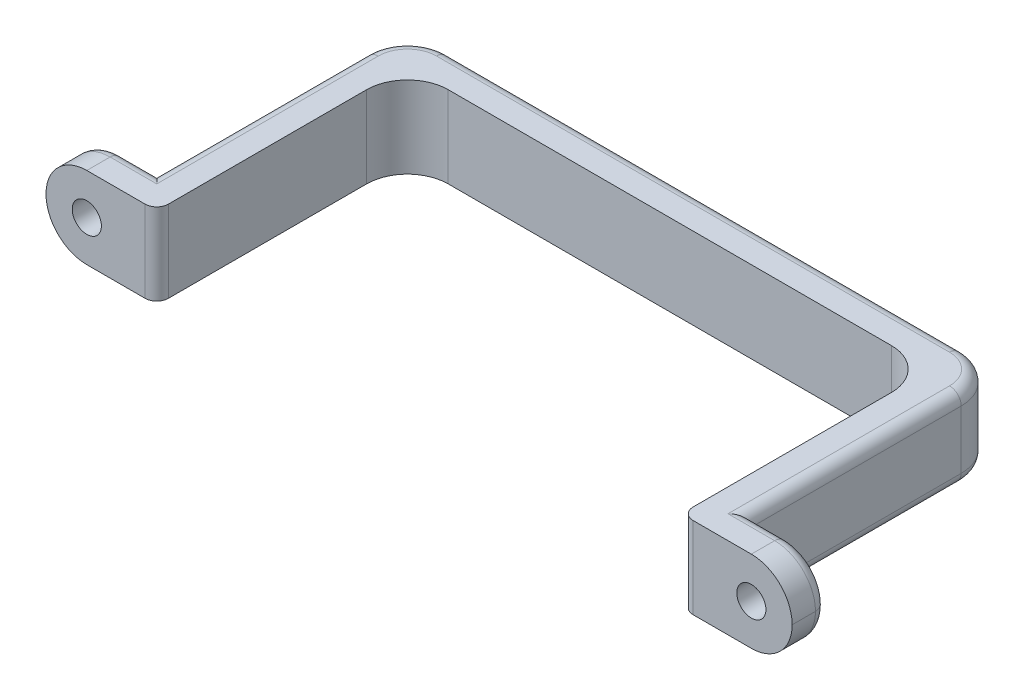
from build123d import *

# Parameters (mm, degrees)
SKETCH_1_W          = 6.5
SKETCH_1_H          = 3
SKETCH_1_W_2        = 22.5
EXTRUDE_1_DEPTH     = 7
FILLET_3_R          = 3.5
CUT_EXTRUDE_1_REACH = 70.886
SKETCH_2_R          = 1.25
FILLET_4_R          = 1
FILLET_5_R          = 1


with BuildPart() as part:
    # Эскиз1 → Бобышка-Вытянуть1 (new body)
    with BuildSketch(Plane(origin=(0, 0, 0), x_dir=(1, 0, 0), z_dir=(0, 1, 0))):
        with Locations((3.25, 1.5)):
            Rectangle(SKETCH_1_W, SKETCH_1_H)
        Polygon((9.5, 21.5), (9.5, 24.5), (6.5, 24.5), (6.5, 3), (6.5, 0), (9.5, 0), align=None)
        with Locations((20.75, 23)):
            Rectangle(SKETCH_1_W_2, SKETCH_1_H)
        with Locations((43.25, 23)):
            Rectangle(SKETCH_1_W_2, SKETCH_1_H)
        Polygon((57.5, 24.5), (54.5, 24.5), (54.5, 21.5), (54.5, 0), (57.5, 0), (57.5, 3), align=None)
        with Locations((60.75, 1.5)):
            Rectangle(SKETCH_1_W, SKETCH_1_H)
    extrude(amount=EXTRUDE_1_DEPTH)

    # Скругление3
    fillet_3_edges = [part.edges().sort_by_distance(p)[0] for p in [
        (64, 0, -1.5),
        (64, 7, -1.5),
        (0, 0, -1.5),
        (0, 7, -1.5),
        (57.5, 3.5, -24.5),
        (6.5, 3.5, -24.5),
        (54.5, 3.5, -21.5),
        (9.5, 3.5, -21.5),
    ]]
    fillet(fillet_3_edges, radius=FILLET_3_R - 0.0001)  # a hair under: the kernel refuses the full size

    # Эскиз2 → Вырез-Вытянуть1 (cut, up to next)
    with BuildSketch(Plane.XY, mode=Mode.PRIVATE) as cut_extrude_1_sk1:
        with Locations((3.5, 3.5)):
            Circle(SKETCH_2_R)
    cut_extrude_1_tool1 = extrude(cut_extrude_1_sk1.sketch, amount=-CUT_EXTRUDE_1_REACH, mode=Mode.PRIVATE) & part.part
    # Эскиз2 → Вырез-Вытянуть1 (cut, up to next)
    with BuildSketch(Plane.XY, mode=Mode.PRIVATE) as cut_extrude_1_sk2:
        with Locations((60.5, 3.5)):
            Circle(SKETCH_2_R)
    cut_extrude_1_tool2 = extrude(cut_extrude_1_sk2.sketch, amount=-CUT_EXTRUDE_1_REACH, mode=Mode.PRIVATE) & part.part
    add(cut_extrude_1_tool1.solids().sort_by_distance((3.5, 3.5, 0))[0], mode=Mode.SUBTRACT)
    add(cut_extrude_1_tool2.solids().sort_by_distance((60.5, 3.5, 0))[0], mode=Mode.SUBTRACT)

    # Скругление4
    fillet_4_edges = [part.edges().sort_by_distance(p)[0] for p in [
        (6.5, 0, -12.00005),
        (57.5, 0, -12.00005),
        (57.5, 7, -12.00005),
        (59.00005, 7, -3),
        (32, 7, -24.5),
        (4.99995, 7, -3),
        (7.525096977, 7, -23.474903023),
        (56.474903023, 7, -23.474903023),
        (59.00005, 0, -3),
        (62.974903023, 1.025096977, -3),
        (62.974903023, 5.974903023, -3),
        (6.5, 7, -12.00005),
        (4.99995, 0, -3),
        (32, 0, -24.5),
        (7.525096977, 0, -23.474903023),
        (56.474903023, 0, -23.474903023),
        (1.025096977, 5.974903023, -3),
        (1.025096977, 1.025096977, -3),
    ]]
    fillet(fillet_4_edges, radius=FILLET_4_R)

    # Скругление5
    fillet_5_edges = [part.edges().sort_by_distance(p)[0] for p in [
        (54.5, 3.5, 0),
        (9.5, 3.5, 0),
    ]]
    fillet(fillet_5_edges, radius=FILLET_5_R)


solid = part.part
